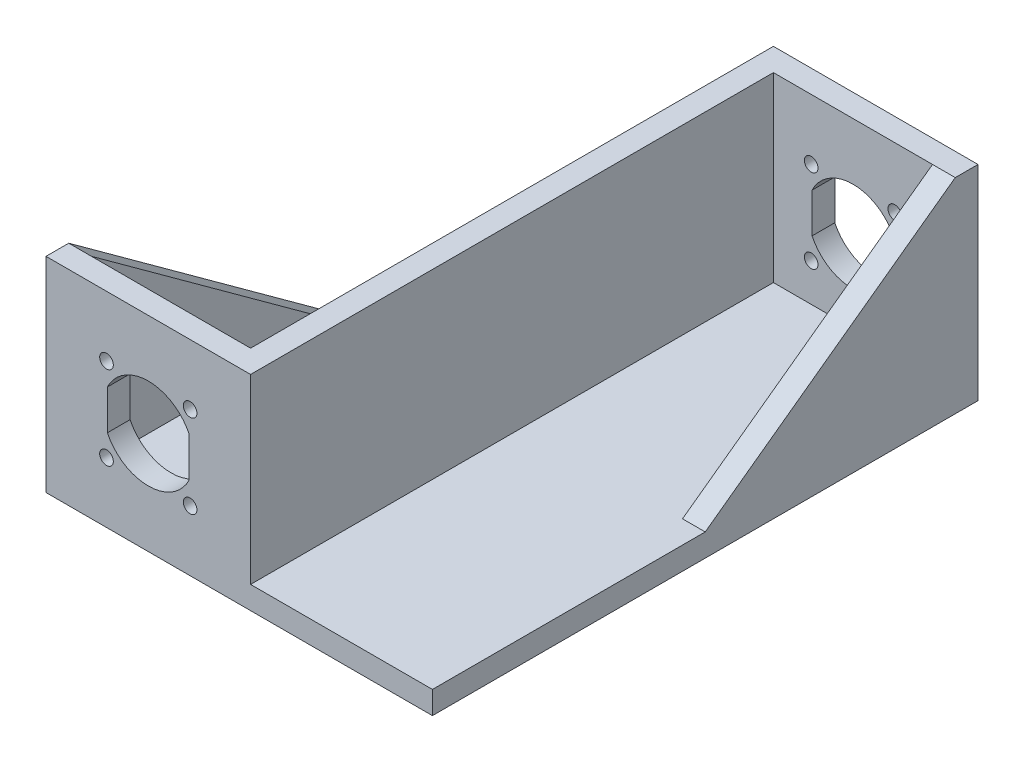
from build123d import *

# Parameters (mm, degrees)
ESQUISSE1_W             = 45
ESQUISSE1_H             = 45
ESQUISSE1_R             = 1.5
EXTRUSION1_DEPTH        = 5
ESQUISSE2_W             = 45
ESQUISSE2_H             = 5
EXTRUSION2_DEPTH        = 115
EXTRUSION3_DEPTH        = 5
ESQUISSE4_W             = 115
ESQUISSE4_H             = 40
EXTRUSION4_DEPTH        = 5
ESQUISSE5_W             = 120
ESQUISSE5_H             = 5
EXTRUSION5_DEPTH        = 40
ESQUISSE6_W             = 40
ESQUISSE6_H             = 40
EXTRUSION6_DEPTH        = 5
EXTRUSION7_DEPTH        = 5
ENL_V_MAT_EXTRU_1_REACH = 137.831
ESQUISSE8_R             = 1.5


with BuildPart() as part:
    # Esquisse1 → Extrusion1 (new body)
    with BuildSketch(Plane.XY):
        with Locations((22.5, 22.5)):
            Rectangle(ESQUISSE1_W, ESQUISSE1_H)
        with Locations((31.692388155, 31.692388155)):
            Circle(ESQUISSE1_R, mode=Mode.SUBTRACT)
        with Locations((31.692388155, 13.307611845)):
            Circle(ESQUISSE1_R, mode=Mode.SUBTRACT)
        with Locations((13.307611845, 13.307611845)):
            Circle(ESQUISSE1_R, mode=Mode.SUBTRACT)
        with Locations((13.307611845, 31.692388155)):
            Circle(ESQUISSE1_R, mode=Mode.SUBTRACT)
        with BuildLine():
            Line((13.5, 26.858898944), (13.5, 18.141101056))
            ThreePointArc((13.5, 18.141101056), (22.5, 12.5), (31.5, 18.141101056))
            Line((31.5, 18.141101056), (31.5, 26.858898944))
            ThreePointArc((31.5, 26.858898944), (22.5, 32.5), (13.5, 26.858898944))
        make_face(mode=Mode.SUBTRACT)
    extrude(amount=EXTRUSION1_DEPTH)

    # Esquisse2 → Extrusion2 (add)
    with BuildSketch(Plane.XY.offset(5)):
        with Locations((22.5, 2.5)):
            Rectangle(ESQUISSE2_W, ESQUISSE2_H)
    extrude(amount=EXTRUSION2_DEPTH)

    # Esquisse3 → Extrusion3 (add)
    with BuildSketch(Plane(origin=(45, 0, 0), x_dir=(0, 0, -1), z_dir=(1, 0, 0))):
        Polygon((-5, 5), (-5, 45), (-60, 5), align=None)
    extrude(amount=-EXTRUSION3_DEPTH)

    # Esquisse4 → Extrusion4 (add)
    with BuildSketch(Plane.ZY):
        with Locations((62.5, 25)):
            Rectangle(ESQUISSE4_W, ESQUISSE4_H)
    extrude(amount=-EXTRUSION4_DEPTH)

    # Esquisse5 → Extrusion5 (add)
    with BuildSketch(Plane.ZY):
        with Locations((60, 2.5)):
            Rectangle(ESQUISSE5_W, ESQUISSE5_H)
    extrude(amount=EXTRUSION5_DEPTH)

    # Esquisse6 → Extrusion6 (add)
    with BuildSketch(Plane.XY.offset(120)):
        with Locations((-20, 25)):
            Rectangle(ESQUISSE6_W, ESQUISSE6_H)
    extrude(amount=-EXTRUSION6_DEPTH)

    # Esquisse7 → Extrusion7 (add)
    with BuildSketch(Plane.ZY.offset(40)):
        Polygon((115, 5), (115, 45), (60, 5), align=None)
    extrude(amount=-EXTRUSION7_DEPTH)

    # Esquisse8 → Enlèv. mat.-Extru.1 (cut, up to next)
    with BuildSketch(Plane.XY.offset(120), mode=Mode.PRIVATE) as enl_v_mat_extru_1_sk1:
        with Locations((-26.692388155, 31.692388155)):
            Circle(ESQUISSE8_R)
    enl_v_mat_extru_1_tool1 = extrude(enl_v_mat_extru_1_sk1.sketch, amount=-ENL_V_MAT_EXTRU_1_REACH, mode=Mode.PRIVATE) & part.part
    # Esquisse8 → Enlèv. mat.-Extru.1 (cut, up to next)
    with BuildSketch(Plane.XY.offset(120), mode=Mode.PRIVATE) as enl_v_mat_extru_1_sk2:
        with Locations((-26.692388155, 13.307611845)):
            Circle(ESQUISSE8_R)
    enl_v_mat_extru_1_tool2 = extrude(enl_v_mat_extru_1_sk2.sketch, amount=-ENL_V_MAT_EXTRU_1_REACH, mode=Mode.PRIVATE) & part.part
    # Esquisse8 → Enlèv. mat.-Extru.1 (cut, up to next)
    with BuildSketch(Plane.XY.offset(120), mode=Mode.PRIVATE) as enl_v_mat_extru_1_sk3:
        with Locations((-8.307611845, 13.307611845)):
            Circle(ESQUISSE8_R)
    enl_v_mat_extru_1_tool3 = extrude(enl_v_mat_extru_1_sk3.sketch, amount=-ENL_V_MAT_EXTRU_1_REACH, mode=Mode.PRIVATE) & part.part
    # Esquisse8 → Enlèv. mat.-Extru.1 (cut, up to next)
    with BuildSketch(Plane.XY.offset(120), mode=Mode.PRIVATE) as enl_v_mat_extru_1_sk4:
        with Locations((-8.307611845, 31.692388155)):
            Circle(ESQUISSE8_R)
    enl_v_mat_extru_1_tool4 = extrude(enl_v_mat_extru_1_sk4.sketch, amount=-ENL_V_MAT_EXTRU_1_REACH, mode=Mode.PRIVATE) & part.part
    # Esquisse8 → Enlèv. mat.-Extru.1 (cut, up to next)
    with BuildSketch(Plane.XY.offset(120), mode=Mode.PRIVATE) as enl_v_mat_extru_1_sk5:
        with BuildLine():
            Line((-26.5, 18.141101056), (-26.5, 26.858898944))
            ThreePointArc((-26.5, 26.858898944), (-17.5, 32.5), (-8.5, 26.858898944))
            Line((-8.5, 26.858898944), (-8.5, 18.141101056))
            ThreePointArc((-8.5, 18.141101056), (-17.5, 12.5), (-26.5, 18.141101056))
        make_face()
    enl_v_mat_extru_1_tool5 = extrude(enl_v_mat_extru_1_sk5.sketch, amount=-ENL_V_MAT_EXTRU_1_REACH, mode=Mode.PRIVATE) & part.part
    add(enl_v_mat_extru_1_tool1.solids().sort_by_distance((-26.692388, 31.692388, 120))[0], mode=Mode.SUBTRACT)
    add(enl_v_mat_extru_1_tool2.solids().sort_by_distance((-26.692388, 13.307612, 120))[0], mode=Mode.SUBTRACT)
    add(enl_v_mat_extru_1_tool3.solids().sort_by_distance((-8.307612, 13.307612, 120))[0], mode=Mode.SUBTRACT)
    add(enl_v_mat_extru_1_tool4.solids().sort_by_distance((-8.307612, 31.692388, 120))[0], mode=Mode.SUBTRACT)
    add(enl_v_mat_extru_1_tool5.solids().sort_by_distance((-17.5, 22.5, 120))[0], mode=Mode.SUBTRACT)


solid = part.part
